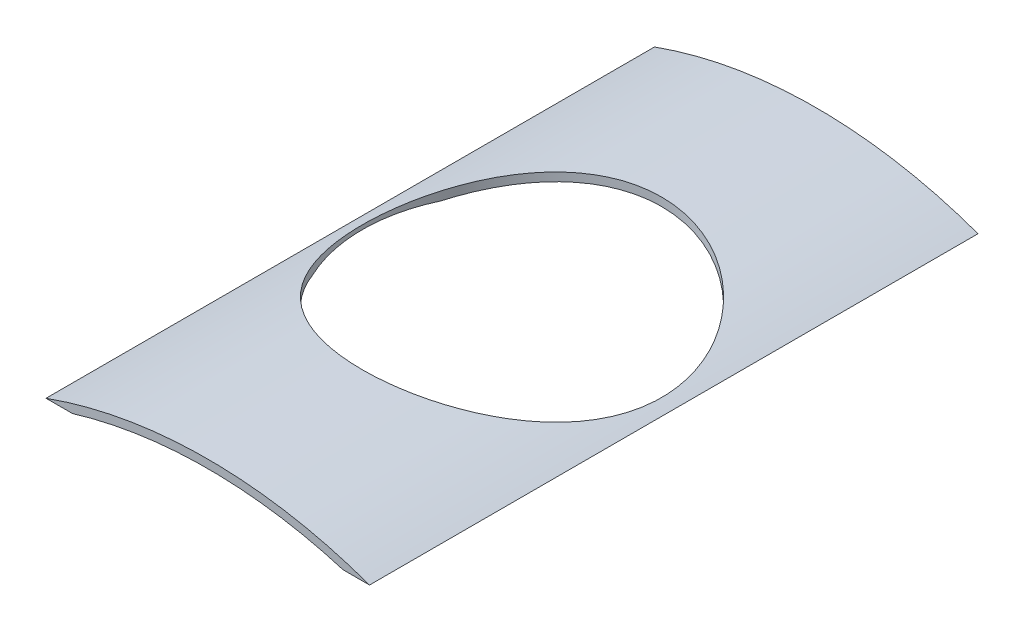
from build123d import *

# Parameters (mm, degrees)
BOSS_EXTRU_1_DEPTH      = 61
ESQUISSE2_R             = 15
ENL_V_MAT_EXTRU_1_DEPTH = 64.182067246


with BuildPart() as part:
    # Esquisse1 → Boss.-Extru.1 (new body)
    with BuildSketch(Plane.XY):
        with BuildLine():
            ThreePointArc((16.215746204, 45), (0, 47.83252476), (-16.215746204, 45))
            Line((-16.215746204, 45), (-13.564659966, 45))
            ThreePointArc((-13.564659966, 45), (0, 47), (13.564659966, 45))
            Line((13.564659966, 45), (16.215746204, 45))
        make_face()
    extrude(amount=BOSS_EXTRU_1_DEPTH)

    # Esquisse2 → Enlèv. mat.-Extru.1 (cut, through all)
    with BuildSketch(Plane.XZ.offset(-45)):
        with Locations((0, 30.5)):
            Circle(ESQUISSE2_R)
    extrude(amount=-ENL_V_MAT_EXTRU_1_DEPTH, mode=Mode.SUBTRACT)


solid = part.part
